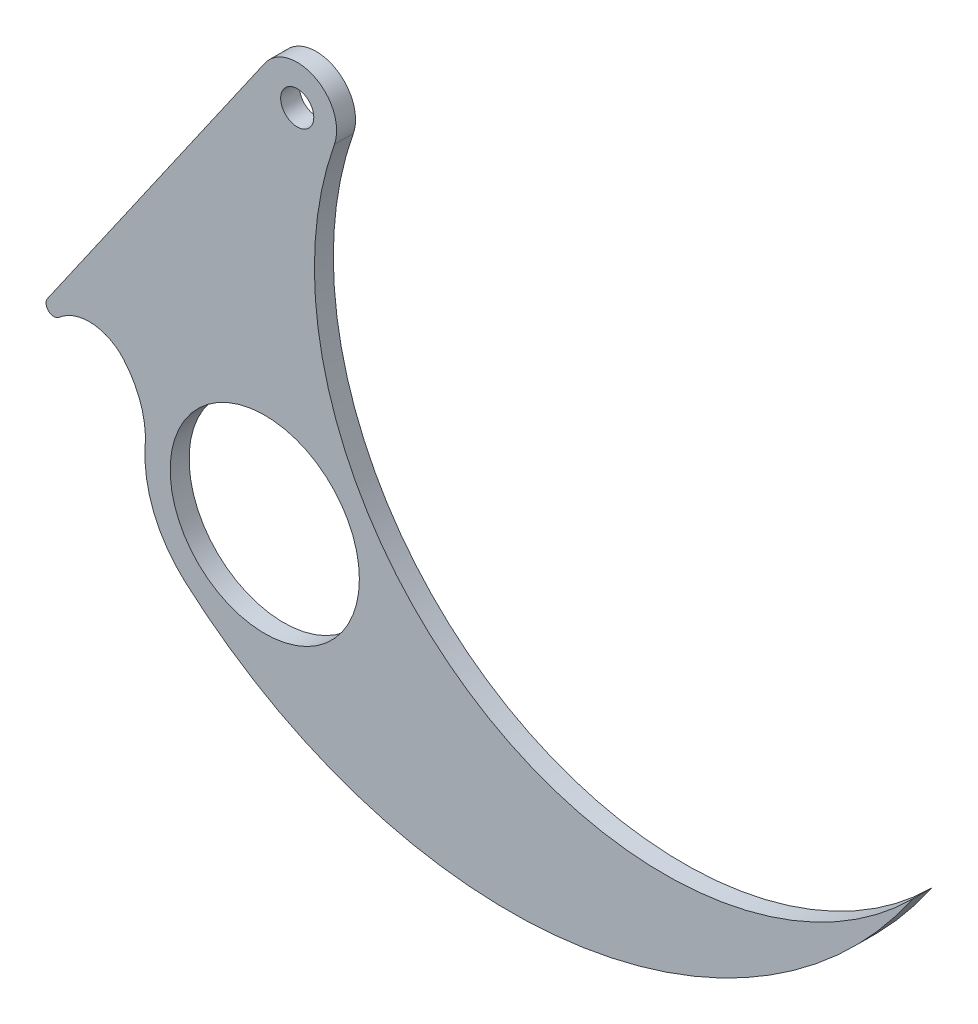
from build123d import *

# Parameters (mm, degrees)
SKETCH_1_R             = 5.25
SKETCH_1_R_2           = 30
SM_BASE_FLANGE_1_DEPTH = 6


# Sheet-metal steps are written as plain solids
with BuildPart() as part:
    # Sketch 1 → Базовая кромка1 (new body)
    with BuildSketch(Plane.XY):
        with BuildLine():
            Line((0.033417561, 126.694802442), (-68.913342264, 27.562479168))
            ThreePointArc((-68.913342264, 27.562479168), (-68.526745087, 24.270869385), (-65.212546165, 24.255447089))
            ThreePointArc((-65.212546165, 24.255447089), (-54.703732736, 27.822860554), (-44.750337246, 22.914549568))
            ThreePointArc((-44.750337246, 22.914549568), (-39.302081877, 13.457030285), (-37.908757817, 2.63174481))
            ThreePointArc((-37.908757817, 2.63174481), (-35.176905519, -14.373076153), (-25.219001767, -28.425375105))
            ThreePointArc((-25.219001767, -28.425375105), (96.595176943, -66.317354816), (205.574554402, 0))
            ThreePointArc((205.574554402, 0), (67.691260765, -15.667826508), (22.08143844, 115.393333105))
            ThreePointArc((22.08143844, 115.393333105), (15.997331025, 130.681317743), (0.033417561, 126.694802442))
        make_face()
        with Locations((10.295453487, 119.557532751)):
            Circle(SKETCH_1_R, mode=Mode.SUBTRACT)
        Circle(SKETCH_1_R_2, mode=Mode.SUBTRACT)
    extrude(amount=-SM_BASE_FLANGE_1_DEPTH)


solid = part.part
